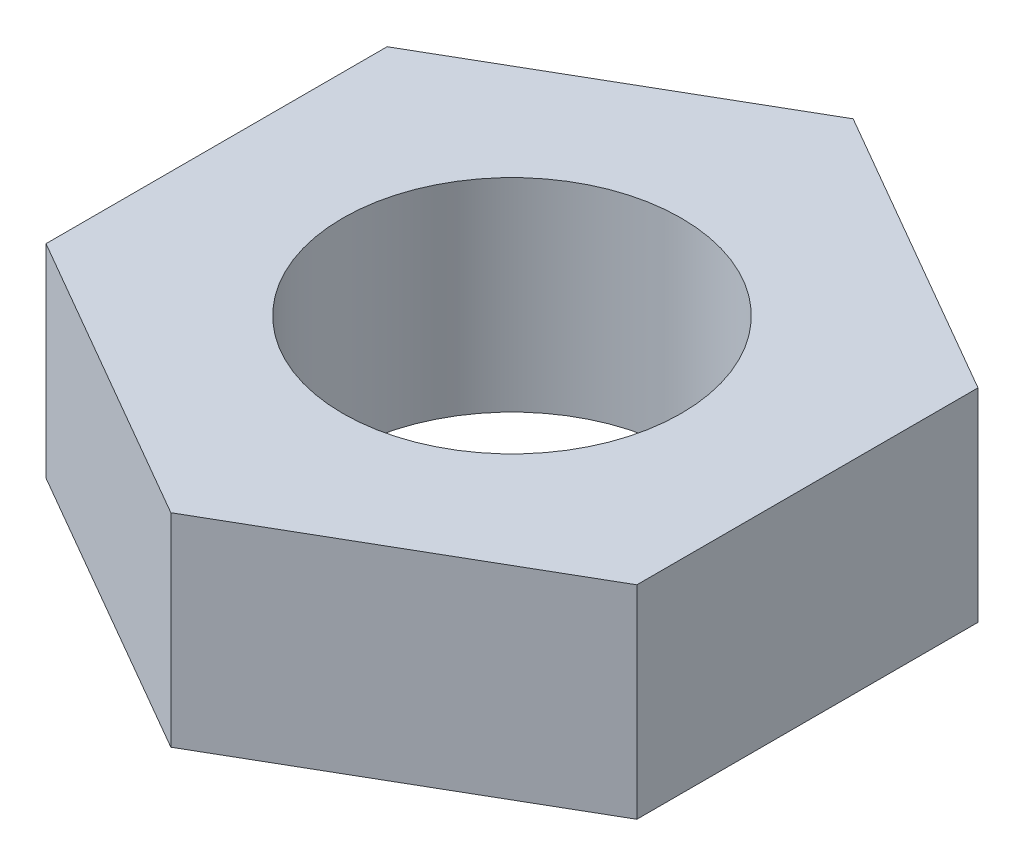
from build123d import *

# Parameters (mm, degrees)
SKETCH2_R           = 7.9375
BOSS_EXTRUDE1_DEPTH = 9.525


with BuildPart() as part:
    # Sketch2 → Boss-Extrude1 (new body)
    with BuildSketch(Plane(origin=(0, 0, 0), x_dir=(1, 0, 0), z_dir=(0, 1, 0))):
        Polygon((0, 16), (-13.856406461, 8), (-13.856406461, -8), (0, -16), (13.856406461, -8), (13.856406461, 8), align=None)
        Circle(SKETCH2_R, mode=Mode.SUBTRACT)
    extrude(amount=BOSS_EXTRUDE1_DEPTH)


solid = part.part
